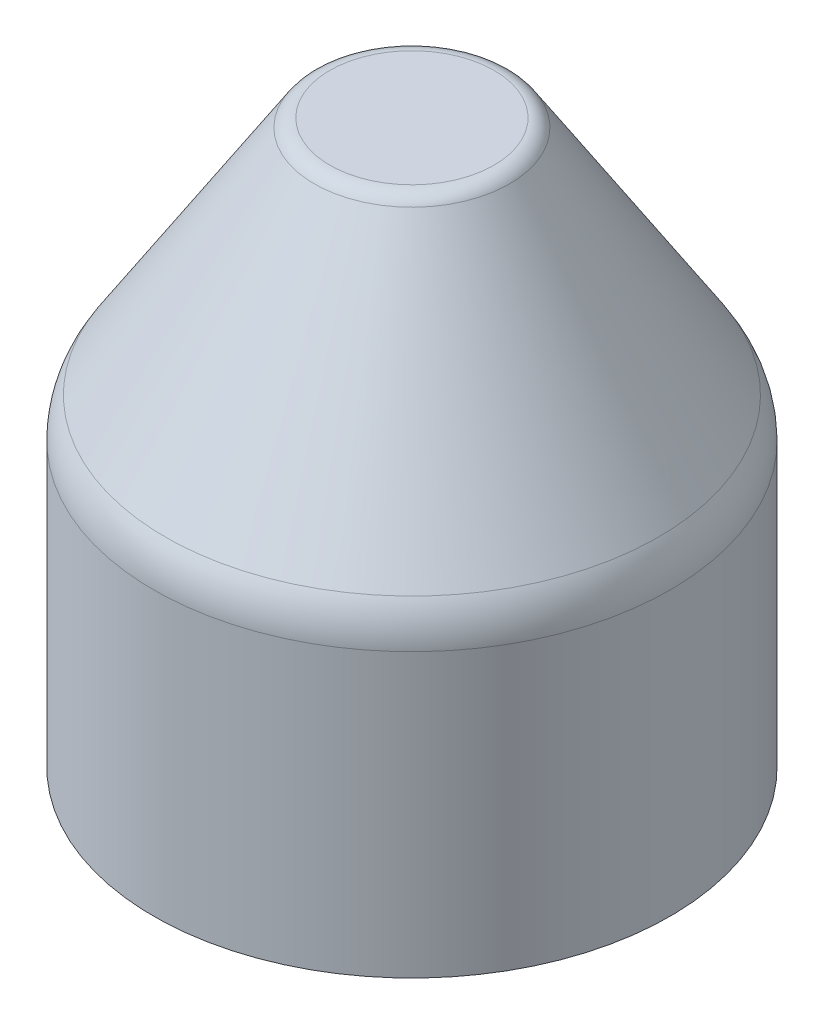
from build123d import *


with BuildPart() as part:
    # Sketch1 → Revolve1 (revolve)
    with BuildSketch(Plane.XY):
        with BuildLine():
            Line((0, 32), (4.454048787, 32))
            ThreePointArc((4.454048787, 32), (4.933236855, 31.877712251), (5.295227263, 31.540757591))
            Line((5.295227263, 31.540757591), (13.364713902, 18.98822282))
            ThreePointArc((13.364713902, 18.98822282), (13.837893667, 17.952389064), (14, 16.825192455))
            Line((14, 16.825192455), (14, 1.5))
            Line((14, 1.5), (10.75, 0))
            Line((10.75, 0), (10, 0))
            Line((10, 0), (10, 16))
            Line((10, 16), (3.8, 16))
            Line((3.8, 16), (3.8, 30))
            Line((3.8, 30), (0, 30))
            Line((0, 30), (0, 32))
        make_face()
    revolve(axis=Axis((0, 0, 0), (0, 1, 0)))


solid = part.part
